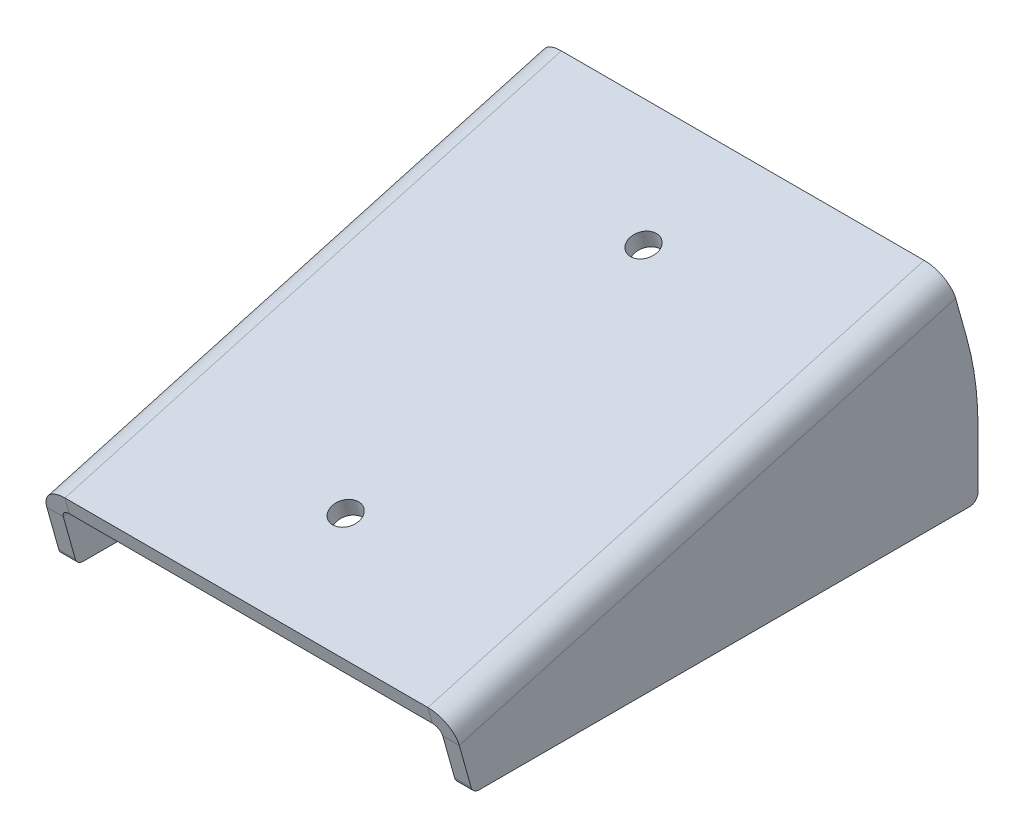
from build123d import *

# Parameters (mm, degrees)
BOSS_EXTRUDE1_DEPTH        = 50
SKETCH2_W                  = 92
SKETCH2_H                  = 47.229685849
CUT_EXTRUDE4_DEPTH         = 152.455959439
CONVERT_SOLID1_START       = -117.963163746
CONVERT_SOLID1_DEPTH       = 125
CONVERT_SOLID1_2_DEPTH     = 125
FILLET1_R                  = 2
FILLET2_R                  = 75
F_6_5_6_5_DIAMETER_HOLE1_D = 6.5
F_6_5_6_5_DIAMETER_HOLE2_D = 6.5


# Read off the part's stored shape, not the designer's step: Convert-Solid1
with BuildPart() as part:
    # Sketch1 → Boss-Extrude1 (new, symmetric)
    with BuildSketch(Plane(origin=(0, 0, 0), x_dir=(0, 0, -1), z_dir=(1, 0, 0))):
        Polygon((-127.407338719, 17.525945159), (-7.036836254, 51.229685849), (0, 26.098127798), (0, 0), (-122.500074074, 0), align=None)
    extrude(amount=BOSS_EXTRUDE1_DEPTH, both=True)

    # Sketch2 → Cut-Extrude4 (cut, through all)
    with BuildSketch(Plane(origin=(0, 1.897341635, -6.776220126), x_dir=(-1, 0, 0), z_dir=(0, 0.2696299255199709, -0.9629640197141818))):
        with Locations((0, 23.614842925)):
            Rectangle(SKETCH2_W, SKETCH2_H)
    extrude(amount=-CUT_EXTRUDE4_DEPTH, mode=Mode.SUBTRACT)

    # Convert-Solid1 outline → Convert-Solid1 (cut)
    with BuildSketch(Plane(origin=(0, 0, 0), x_dir=(1, 0, 0), z_dir=(0, 0.26962992551997095, -0.9629640197141818)).offset(CONVERT_SOLID1_START)):
        with BuildLine():
            Line((50, -51.229685849), (50, -45.229685849))
            ThreePointArc((50, -45.229685849), (48.242640687, -49.472326536), (44, -51.229685849))
            Line((44, -51.229685849), (50, -51.229685849))
        make_face()
        with BuildLine():
            Line((-50, -51.229685849), (-44, -51.229685849))
            ThreePointArc((-44, -51.229685849), (-48.242640687, -49.472326536), (-50, -45.229685849))
            Line((-50, -45.229685849), (-50, -51.229685849))
        make_face()
    extrude(amount=CONVERT_SOLID1_DEPTH, mode=Mode.SUBTRACT)

    # Convert-Solid1 2 outline → Convert-Solid1 2 (add)
    with BuildSketch(Plane(origin=(0, 0, 0), x_dir=(1, 0, 0), z_dir=(0, 0.26962992551997095, -0.9629640197141818)).offset(CONVERT_SOLID1_START)):
        with BuildLine():
            Line((46, -47.229685849), (46, -45.229685849))
            ThreePointArc((46, -45.229685849), (45.414213562, -46.643899411), (44, -47.229685849))
            Line((44, -47.229685849), (46, -47.229685849))
        make_face()
        with BuildLine():
            Line((-46, -47.229685849), (-44, -47.229685849))
            ThreePointArc((-44, -47.229685849), (-45.414213562, -46.643899411), (-46, -45.229685849))
            Line((-46, -45.229685849), (-46, -47.229685849))
        make_face()
    extrude(amount=CONVERT_SOLID1_2_DEPTH)

    # Fillet1
    fillet1_edges = [part.edges().sort_by_distance(p)[0] for p in [
        (48, 0, 122.500074074),
        (48, 0, 0),
        (-48, 0, 0),
        (-48, 0, 122.500074074),
    ]]
    fillet(fillet1_edges, radius=FILLET1_R)

    # Fillet2
    fillet2_edges = [part.edges().sort_by_distance(p)[0] for p in [
        (48, 26.098127798, 0),
        (-48, 26.098127798, 0),
    ]]
    fillet(fillet2_edges, radius=FILLET2_R)

    # Ø6.5 (6.5) Diameter Hole1 (through all)
    with Locations(Plane(origin=(92.5, 101.400740105, -186.980648929), x_dir=(-1, 0, 0), z_dir=(0, -0.9629640197141818, -0.2696299255199709))):
        with Locations((92.5, -300.359475049), (92.5, -225.359475049), (-92.5, -300.359475049), (-92.5, -225.359475049)):
            Hole(F_6_5_6_5_DIAMETER_HOLE1_D / 2)

    # Ø6.5 (6.5) Diameter Hole2 (through all)
    with Locations(Plane(origin=(-92.5, 101.400740105, -186.980648929), x_dir=(-1, 0, 0), z_dir=(0, -0.9629640197141818, -0.2696299255199709))):
        with Locations((92.5, -300.359475049), (92.5, -225.359475049), (-92.5, -300.359475049), (-92.5, -225.359475049)):
            Hole(F_6_5_6_5_DIAMETER_HOLE2_D / 2)


solid = part.part
